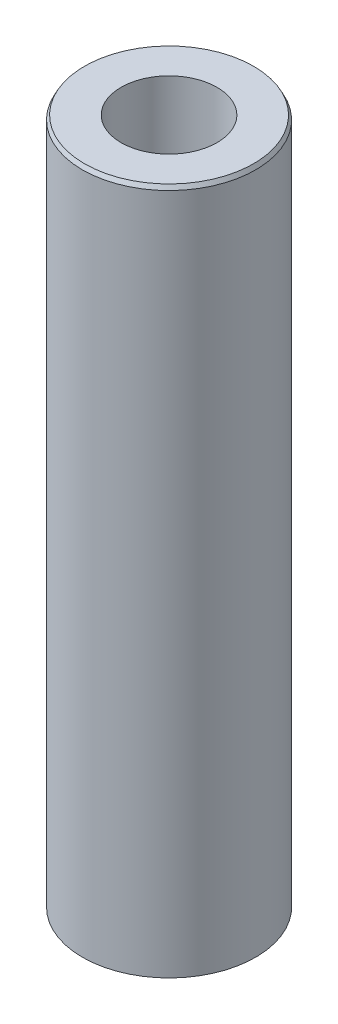
from build123d import *
from OCP.BRepFilletAPI import BRepFilletAPI_MakeChamfer

# Parameters (mm, degrees)
SKETCH1_R           = 37.5
BOSS_EXTRUDE1_DEPTH = 297.808013692
SKETCH2_R           = 20.764392846
CUT_EXTRUDE1_DEPTH  = 303.493161938
CHAMFER1_SIZE       = 1.810855835
CHAMFER1_SIZE2      = 0.932475156


with BuildPart() as part:
    # Sketch1 → Boss-Extrude1 (new body)
    with BuildSketch(Plane(origin=(0, 0, 0), x_dir=(1, 0, 0), z_dir=(0, 1, 0))):
        Circle(SKETCH1_R)
    extrude(amount=BOSS_EXTRUDE1_DEPTH)

    # Sketch2 → Cut-Extrude1 (cut, through all)
    with BuildSketch(Plane(origin=(0, 0, 0), x_dir=(1, 0, 0), z_dir=(0, 1, 0))):
        Circle(SKETCH2_R)
    extrude(amount=CUT_EXTRUDE1_DEPTH, mode=Mode.SUBTRACT)

    # Chamfer1: one chamfer whose edges measure the first distance from different faces: ONE call of the kernel's chamfer builder (chamfer() names one face for all edges)
    chamfer1_edges_1 = [part.edges().sort_by_distance(p)[0] for p in [
        (-37.5, 297.808013692, 0),
    ]]
    chamfer1_side_1 = [part.faces().sort_by_distance(p)[0] for p in [
        (-37.5, 148.904006846, 0),
    ]]
    chamfer1_edges_2 = [part.edges().sort_by_distance(p)[0] for p in [
        (-37.5, 0, 0),
    ]]
    chamfer1_side_2 = [part.faces().sort_by_distance(p)[0] for p in [
        (-36.439339828, 0, 0),
    ]]
    chamfer1 = BRepFilletAPI_MakeChamfer(part.part.solid().wrapped)
    for e in chamfer1_edges_1:
        chamfer1.Add(CHAMFER1_SIZE, CHAMFER1_SIZE2, e.wrapped, chamfer1_side_1[0].wrapped)  # the first distance lies on this face
    for e in chamfer1_edges_2:
        chamfer1.Add(CHAMFER1_SIZE, CHAMFER1_SIZE2, e.wrapped, chamfer1_side_2[0].wrapped)  # the first distance lies on this face
    add(Compound.cast(chamfer1.Shape()), mode=Mode.REPLACE)


solid = part.part
